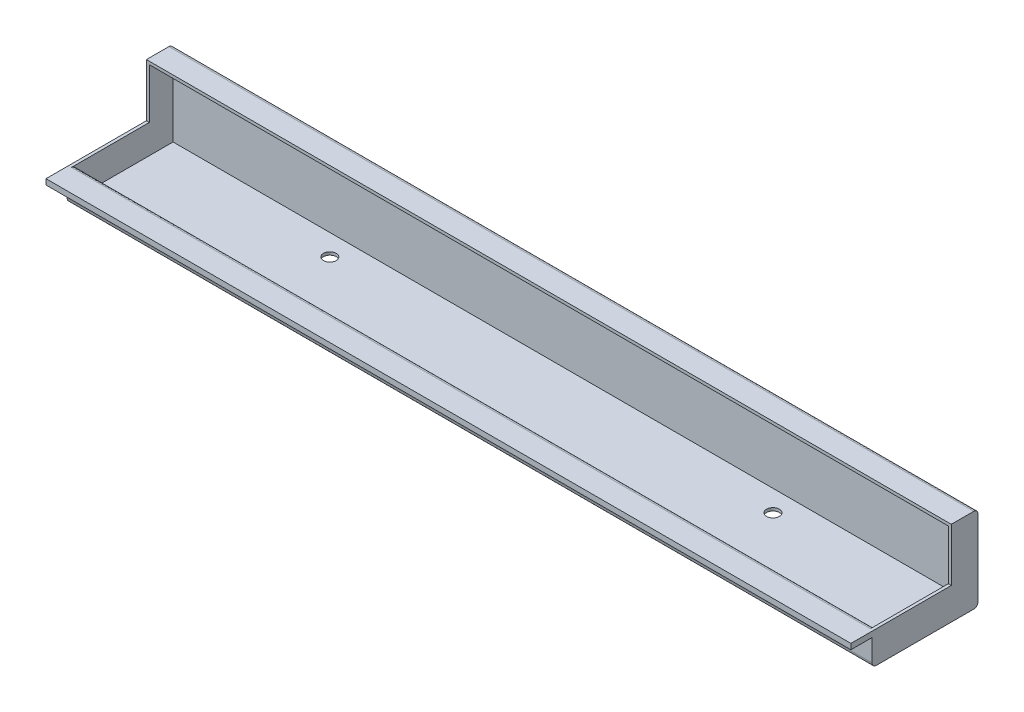
from build123d import *

# Parameters (mm, degrees)
SKETCH1_W           = 482.6
SKETCH1_H           = 50.8
BOSS_EXTRUDE1_DEPTH = 76.2
CUT_EXTRUDE2_DEPTH  = 49.022
SKETCH3_W           = 482.6
SKETCH3_H           = 16.002
CUT_EXTRUDE3_DEPTH  = 31.75
SKETCH4_W           = 482.6
SKETCH4_H           = 15.748
CUT_EXTRUDE4_DEPTH  = 12.7
SHELL2_START        = -23.622
SHELL2_OUTLINE_W    = 479.044
SHELL2_OUTLINE_H    = 14.224
SHELL2_DEPTH        = 47.244
SKETCH5_W           = 1.778
SKETCH5_H           = 17.272
BOSS_EXTRUDE2_DEPTH = 44.45
FILLET1_R           = 2.54
SKETCH6_R           = 3.81
CUT_EXTRUDE5_DEPTH  = 44.45


# Read off the part's stored shape, not the designer's step: Shell2
with BuildPart() as part:
    # Sketch1 → Boss-Extrude1 (new body)
    with BuildSketch(Plane.XY):
        Rectangle(SKETCH1_W, SKETCH1_H)
    extrude(amount=BOSS_EXTRUDE1_DEPTH)

    # Sketch2 → Cut-Extrude2 (cut)
    with BuildSketch(Plane(origin=(0, 25.4, 0), x_dir=(1, 0, 0), z_dir=(0, 1, 0))):
        Polygon((241.3, -16.002), (-241.3, -16.002), (-241.3, -38.1), (-241.3, -60.198), (241.3, -60.198), align=None)
    extrude(amount=-CUT_EXTRUDE2_DEPTH, mode=Mode.SUBTRACT)

    # Sketch3 → Cut-Extrude3 (cut)
    with BuildSketch(Plane(origin=(0, 25.4, 0), x_dir=(1, 0, 0), z_dir=(0, 1, 0))):
        with Locations((0, -68.199)):
            Rectangle(SKETCH3_W, SKETCH3_H)
    extrude(amount=-CUT_EXTRUDE3_DEPTH, mode=Mode.SUBTRACT)

    # Sketch4 → Cut-Extrude4 (cut)
    with BuildSketch(Plane.XY.offset(76.2)):
        with Locations((0, -17.526)):
            Rectangle(SKETCH4_W, SKETCH4_H)
    extrude(amount=-CUT_EXTRUDE4_DEPTH, mode=Mode.SUBTRACT)

    # Shell2 outline → Shell2 (cut)
    with BuildSketch(Plane(origin=(0, 0, 0), x_dir=(1, 0, 0), z_dir=(0, 1, 0)).offset(SHELL2_START)):
        with Locations((0, -8.89)):
            Rectangle(SHELL2_OUTLINE_W, SHELL2_OUTLINE_H)
    extrude(amount=SHELL2_DEPTH, mode=Mode.SUBTRACT)

    # Sketch5 → Boss-Extrude2 (add)
    with BuildSketch(Plane(origin=(0, 0, 60.198), x_dir=(-1, 0, 0), z_dir=(0, 0, -1))):
        with Locations((240.411, -14.986)):
            Rectangle(SKETCH5_W, SKETCH5_H)
        with Locations((-240.411, -14.986)):
            Rectangle(SKETCH5_W, SKETCH5_H)
    extrude(amount=BOSS_EXTRUDE2_DEPTH)

    # Fillet1
    fillet1_edges = [part.edges().sort_by_distance(p)[0] for p in [
        (0, -25.4, 0),
        (0, -25.4, 63.5),
        (0, 25.4, 0),
        (0, -6.35, 60.198),
    ]]
    fillet(fillet1_edges, radius=FILLET1_R)

    # Sketch6 → Cut-Extrude5 (cut)
    with BuildSketch(Plane(origin=(0, -23.622, 0), x_dir=(1, 0, 0), z_dir=(0, 1, 0))):
        with Locations(Location((-132.842, -14.478, 0), (0, 0, 270))):
            Circle(SKETCH6_R)
        with Locations(Location((132.842, -14.478, 0), (0, 0, 270))):
            Circle(SKETCH6_R)
    extrude(amount=-CUT_EXTRUDE5_DEPTH, mode=Mode.SUBTRACT)


solid = part.part
